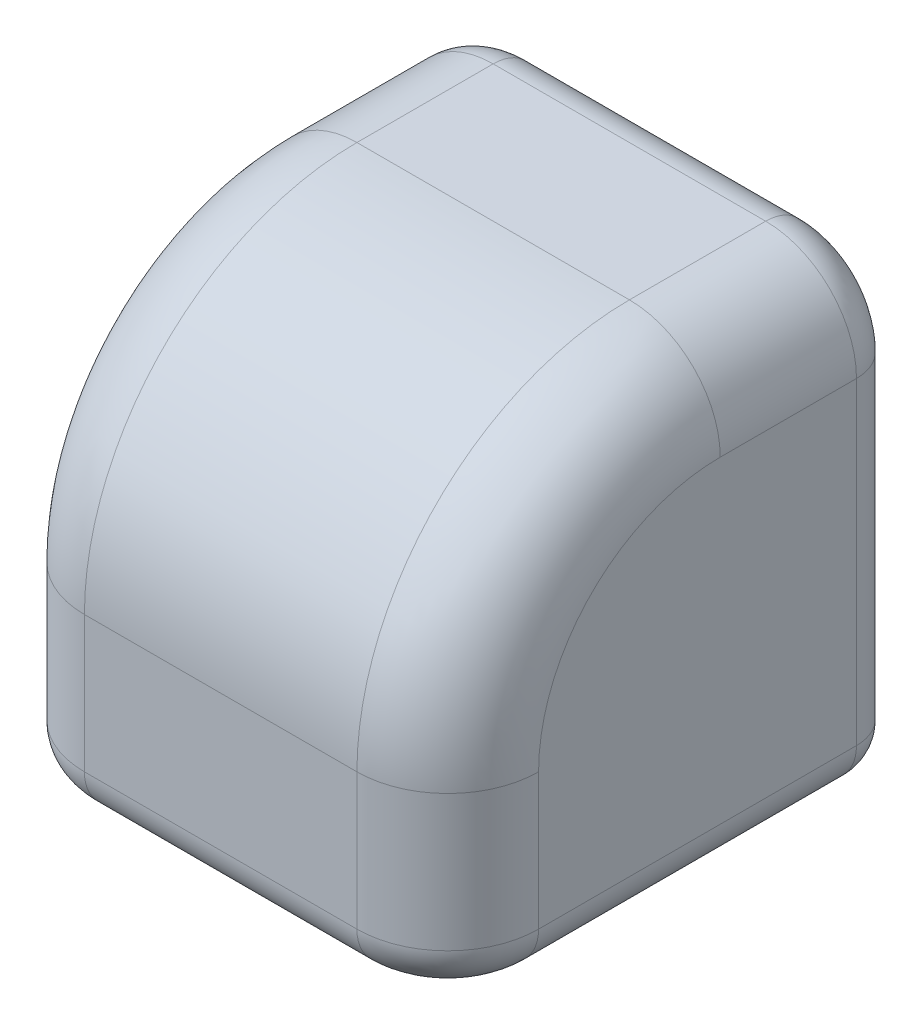
from build123d import *

# Parameters (mm, degrees)
SKETCH1_W           = 50
SKETCH1_H           = 50
BOSS_EXTRUDE1_DEPTH = 50
SKETCH2_R           = 20
CUT_EXTRUDE1_DEPTH  = 5
SKETCH3_R           = 20
CUT_EXTRUDE5_DEPTH  = 2
FILLET10_R          = 30
FILLET11_R          = 10
FILLET12_R          = 10
FILLET15_R          = 5
FILLET16_R          = 5


with BuildPart() as part:
    # Sketch1 → Boss-Extrude1 (new body)
    with BuildSketch(Plane(origin=(0, 0, 0), x_dir=(1, 0, 0), z_dir=(0, 1, 0))):
        Rectangle(SKETCH1_W, SKETCH1_H)
    extrude(amount=BOSS_EXTRUDE1_DEPTH)

    # Sketch2 → Cut-Extrude1 (cut)
    with BuildSketch(Plane(origin=(0, 0, -25), x_dir=(-1, 0, 0), z_dir=(0, 0, -1))):
        with Locations((0, 25)):
            Circle(SKETCH2_R)
    extrude(amount=-CUT_EXTRUDE1_DEPTH, mode=Mode.SUBTRACT)

    # Sketch3 → Cut-Extrude5 (cut)
    with BuildSketch(Plane.XZ):
        with Locations(Location((0, 0, 0), (0, 0, 270))):
            Circle(SKETCH3_R)
    extrude(amount=-CUT_EXTRUDE5_DEPTH, mode=Mode.SUBTRACT)

    # Fillet10
    fillet10_edges = [part.edges().sort_by_distance(p)[0] for p in [
        (0, 50, 25),
    ]]
    fillet(fillet10_edges, radius=FILLET10_R)

    # Fillet11
    fillet11_edges = [part.edges().sort_by_distance(p)[0] for p in [
        (25, 50, -15),
        (25, 10, 25),
        (25, 41.213203436, 16.213203436),
    ]]
    fillet(fillet11_edges, radius=FILLET11_R)

    # Fillet12
    fillet12_edges = [part.edges().sort_by_distance(p)[0] for p in [
        (-25, 50, -15),
        (-25, 10, 25),
        (-25, 41.213203436, 16.213203436),
    ]]
    fillet(fillet12_edges, radius=FILLET12_R)

    # Fillet15
    fillet15_edges = [part.edges().sort_by_distance(p)[0] for p in [
        (25, 0, -5),
        (22.071067812, 0, 22.071067812),
        (0, 0, 25),
        (-22.071067812, 0, 22.071067812),
        (-25, 0, -5),
    ]]
    fillet(fillet15_edges, radius=FILLET15_R - 0.0001)  # a hair under: the kernel refuses the full size

    # Fillet16
    fillet16_edges = [part.edges().sort_by_distance(p)[0] for p in [
        (25, 22.49995, -25),
        (0, 50, -25),
        (22.071067812, 47.071067812, -25),
        (-25, 22.49995, -25),
        (-22.071067812, 47.071067812, -25),
        (0, 0, -25),
        (-23.535563195, 1.464436805, -25),
        (23.535563195, 1.464436805, -25),
    ]]
    fillet(fillet16_edges, radius=FILLET16_R - 0.0001)  # a hair under: the kernel refuses the full size


solid = part.part
